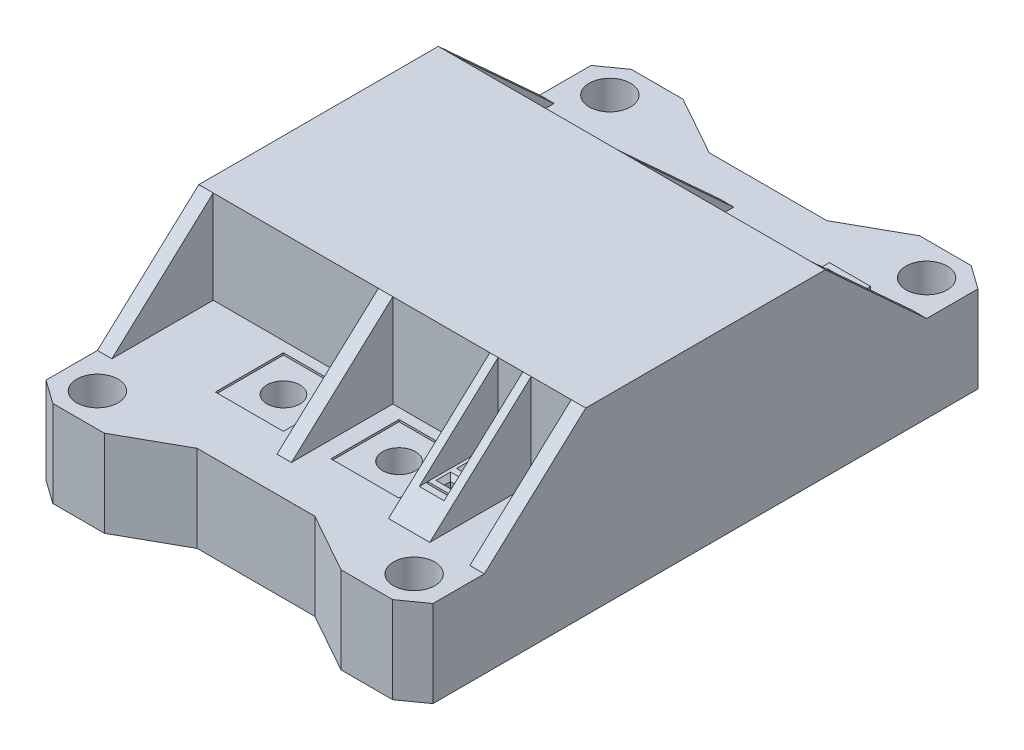
from build123d import *

# Parameters (mm, degrees)
BOSS_EXTRUDE1_DEPTH        = 10.668
SKETCH3_R                  = 2.54
CUT_EXTRUDE1_DEPTH         = 45.123624398
CHAMFER1_SIZE              = 0.00254
SKETCH4_W                  = 29.464
SKETCH4_H                  = 11.43
BOSS_EXTRUDE2_DEPTH        = 47.603865979
RIB1_REACH                 = 51.045
SKETCH5_WALL_W             = 117.009615236
SKETCH5_WALL_H             = 1.778
RIB2_REACH                 = 65.411
SKETCH6_WALL_W             = 145.742114112
SKETCH6_WALL_H             = 1.778
RIB3_START                 = -1.778
RIB3_DEPTH                 = 1.778
RIB4_START                 = -5.08
RIB4_DEPTH                 = 5.08
SKETCH9_W                  = 3.048
SKETCH9_H                  = 8.89
CUT_EXTRUDE2_DEPTH         = 60.891794651
SKETCH13_W                 = 2.54
SKETCH13_H                 = 8.128
BOSS_EXTRUDE3_DEPTH        = 0.254
SKETCH14_W                 = 0.762
SKETCH14_H                 = 0.762
CUT_EXTRUDE4_DEPTH         = 6.096
CHAMFER2_SIZE              = 0.508
LPATTERN1_COUNT            = 3
LPATTERN1_PITCH            = 2.54
CHAMFER2_OF_LPATTERN1_SIZE = 0.508
SKETCH15_W                 = 5.08
SKETCH15_H                 = 8.128
BOSS_EXTRUDE4_DEPTH        = 2.794
SKETCH16_W                 = 0.762
SKETCH16_H                 = 0.762
CUT_EXTRUDE5_DEPTH         = 6.096
CHAMFER3_SIZE              = 0.508
LPATTERN2_COUNT            = 3
LPATTERN2_PITCH            = 2.413
LPATTERN2_COUNT_DIR2       = 2
LPATTERN2_PITCH_DIR2       = 2.286
CHAMFER3_OF_LPATTERN2_SIZE = 0.508
SKETCH18_W                 = 8.382
SKETCH18_H                 = 8.382
CUT_EXTRUDE6_DEPTH         = 0.254
SKETCH19_R                 = 2.032
CUT_EXTRUDE7_DEPTH         = 45.380219265
MIRROR5_COPY_1_SKETCH_W    = 8.382
MIRROR5_COPY_1_SKETCH_H    = 8.382
MIRROR5_COPY_1_DEPTH       = 0.254
MIRROR5_COPY_2_SKETCH_R    = 2.032
MIRROR5_COPY_2_DEPTH       = 45.380219265


# Read off the part's stored shape, not the designer's step: Rib3, Rib4
with BuildPart() as part:
    # Sketch1 → Boss-Extrude1 (new body)
    with BuildSketch(Plane(origin=(0, 0, 0), x_dir=(1, 0, 0), z_dir=(0, 1, 0))):
        Polygon((0, 31.496), (7.239, 31.496), (14.553894525, 35.588705961), (20.903894525, 35.588705961), (23.801932989, 33.528), (23.801932989, 0), (0, 0), align=None)
    boss_extrude1 = extrude(amount=BOSS_EXTRUDE1_DEPTH)

    # Sketch3 → Cut-Extrude1 (cut, through all)
    with BuildSketch(Plane(origin=(0, 10.668, 0), x_dir=(1, 0, 0), z_dir=(0, 1, 0))):
        with Locations(Location((19.483932989, 31.524705961, 0), (0, 0, 270))):
            Circle(SKETCH3_R)
    cut_extrude1 = extrude(amount=-CUT_EXTRUDE1_DEPTH, mode=Mode.SUBTRACT)

    # Mirror1: Boss-Extrude1, Cut-Extrude1 across plane
    add(boss_extrude1.mirror(Plane(origin=(0, 0, 0), x_dir=(0, 0, 1), z_dir=(1, 0, 0))))
    add(cut_extrude1.mirror(Plane(origin=(0, 0, 0), x_dir=(0, 0, 1), z_dir=(1, 0, 0))), mode=Mode.SUBTRACT)

    # Mirror2: part across plane


with BuildPart() as part_1:
    add(part.part)
    add(part.part.mirror(Plane.XY))

    # Chamfer1
    chamfer1_edges = [part_1.edges().sort_by_distance(p)[0] for p in [
        (0, 10.668, -31.496),
        (0, 10.668, 31.496),
    ]]
    chamfer(chamfer1_edges, length=CHAMFER1_SIZE)

    # Sketch4 → Boss-Extrude2 (add)
    with BuildSketch(Plane(origin=(23.801932989, 0, 0), x_dir=(0, 0, -1), z_dir=(1, 0, 0))):
        with Locations((0, 16.383)):
            Rectangle(SKETCH4_W, SKETCH4_H)
    extrude(amount=-BOSS_EXTRUDE2_DEPTH)

    # Sketch5 wall → Rib1 (add, up to next)
    with BuildSketch(Plane(origin=(-1.703932989, 16.383, 20.96935298), x_dir=(0, -0.675559301544, 0.737305655816), z_dir=(0, -0.737305655816, -0.675559301544)), mode=Mode.PRIVATE) as rib1_sk1:
        with Locations((0, -0.889)):
            Rectangle(SKETCH5_WALL_W, SKETCH5_WALL_H)
    rib1_tool1 = extrude(rib1_sk1.sketch, amount=RIB1_REACH, mode=Mode.PRIVATE) - part_1.part
    rib1 = rib1_tool1.solids().sort_by_distance((-1.703932989, 16.383, 20.96935298))[0]
    add(rib1)

    # Sketch6 wall → Rib2 (add, up to next)
    with BuildSketch(Plane(origin=(23.801932989, 16.383, 20.96935298), x_dir=(0, -0.675559301544, 0.737305655816), z_dir=(0, -0.737305655816, -0.675559301544)), mode=Mode.PRIVATE) as rib2_sk1:
        with Locations((0, 0.889)):
            Rectangle(SKETCH6_WALL_W, SKETCH6_WALL_H)
    rib2_tool1 = extrude(rib2_sk1.sketch, amount=RIB2_REACH, mode=Mode.PRIVATE) - part_1.part
    rib2 = rib2_tool1.solids().sort_by_distance((23.801932989, 16.383, 20.96935298))[0]
    add(rib2)

    # Rib3 outline → Rib3 (add)
    with BuildSketch(Plane.ZY.offset(23.801932989).offset(RIB3_START)):
        Polygon((27.206705961, 10.668), (14.732, 22.098), (14.732, 10.668), align=None)
    rib3 = extrude(amount=RIB3_DEPTH)

    # Rib4 outline → Rib4 (add)
    with BuildSketch(Plane.ZY.offset(-12.012067011).offset(RIB4_START)):
        Polygon((27.206705961, 10.668), (14.732, 22.098), (14.732, 10.668), align=None)
    extrude(amount=RIB4_DEPTH)

    # Sketch9 → Cut-Extrude2 (cut, through all)
    with BuildSketch(Plane.XY.offset(14.732)):
        with Locations((14.552067011, 17.653)):
            Rectangle(SKETCH9_W, SKETCH9_H)
    extrude(amount=CUT_EXTRUDE2_DEPTH, mode=Mode.SUBTRACT)

    # Sketch13 → Boss-Extrude3 (add)
    with BuildSketch(Plane(origin=(0, 13.208, 0), x_dir=(1, 0, 0), z_dir=(0, 1, 0))):
        with Locations((14.552067011, -19.583274541)):
            Rectangle(SKETCH13_W, SKETCH13_H)
    extrude(amount=BOSS_EXTRUDE3_DEPTH)

    # Sketch14 → Cut-Extrude4 (cut)
    with BuildSketch(Plane(origin=(0, 13.462, 0), x_dir=(1, 0, 0), z_dir=(0, 1, 0))):
        with Locations((14.552067011, -17.043274541)):
            Rectangle(SKETCH14_W, SKETCH14_H)
    cut_extrude4 = extrude(amount=-CUT_EXTRUDE4_DEPTH, mode=Mode.SUBTRACT)

    # Chamfer2
    chamfer2_edges = [part_1.edges().sort_by_distance(p)[0] for p in [
        (14.933067011, 13.462, 17.043274541),
        (14.552067011, 13.462, 16.662274541),
        (14.171067011, 13.462, 17.043274541),
        (14.552067011, 13.462, 17.424274541),
    ]]
    chamfer(chamfer2_edges, length=CHAMFER2_SIZE)

    # LPattern1: Cut-Extrude4 ×3
    with Locations(*[(0, 0, i * LPATTERN1_PITCH) for i in range(1, LPATTERN1_COUNT)]):
        add(cut_extrude4, mode=Mode.SUBTRACT)

    # Chamfer2 of LPattern1
    chamfer2_of_lpattern1_edges = [part_1.edges().sort_by_distance(p)[0] for p in [
        (14.933067011, 13.462, 19.583274541),
        (14.552067011, 13.462, 19.202274541),
        (14.171067011, 13.462, 19.583274541),
        (14.552067011, 13.462, 19.964274541),
        (14.933067011, 13.462, 22.123274541),
        (14.552067011, 13.462, 21.742274541),
        (14.171067011, 13.462, 22.123274541),
        (14.552067011, 13.462, 22.504274541),
    ]]
    chamfer(chamfer2_of_lpattern1_edges, length=CHAMFER2_OF_LPATTERN1_SIZE)

    # Mirror3: Rib1, Rib2, Rib3 across plane
    add(rib1.mirror(Plane.XY))
    add(rib2.mirror(Plane.XY))
    add(rib3.mirror(Plane.XY))

    # Sketch15 → Boss-Extrude4 (add)
    with BuildSketch(Plane(origin=(0, 10.668, 0), x_dir=(1, 0, 0), z_dir=(0, 1, 0))):
        with Locations((17.197932989, 20.32)):
            Rectangle(SKETCH15_W, SKETCH15_H)
    extrude(amount=BOSS_EXTRUDE4_DEPTH)

    # Sketch16 → Cut-Extrude5 (cut)
    with BuildSketch(Plane(origin=(0, 13.462, 0), x_dir=(1, 0, 0), z_dir=(0, 1, 0))):
        with Locations((18.340932989, 17.907)):
            Rectangle(SKETCH16_W, SKETCH16_H)
    cut_extrude5 = extrude(amount=-CUT_EXTRUDE5_DEPTH, mode=Mode.SUBTRACT)

    # Chamfer3
    chamfer3_edges = [part_1.edges().sort_by_distance(p)[0] for p in [
        (18.721932989, 13.462, -17.907),
        (18.340932989, 13.462, -18.288),
        (17.959932989, 13.462, -17.907),
        (18.340932989, 13.462, -17.526),
    ]]
    chamfer(chamfer3_edges, length=CHAMFER3_SIZE)

    # LPattern2: Cut-Extrude5 3 × 2
    with Locations(*[(-j * LPATTERN2_PITCH_DIR2, 0, -i * LPATTERN2_PITCH) for i in range(LPATTERN2_COUNT) for j in range(LPATTERN2_COUNT_DIR2) if (i, j) != (0, 0)]):
        add(cut_extrude5, mode=Mode.SUBTRACT)

    # Chamfer3 of LPattern2
    chamfer3_of_lpattern2_edges = [part_1.edges().sort_by_distance(p)[0] for p in [
        (16.435932989, 13.462, -17.907),
        (16.054932989, 13.462, -18.288),
        (15.673932989, 13.462, -17.907),
        (16.054932989, 13.462, -17.526),
        (18.721932989, 13.462, -20.32),
        (18.340932989, 13.462, -20.701),
        (17.959932989, 13.462, -20.32),
        (18.340932989, 13.462, -19.939),
        (16.435932989, 13.462, -20.32),
        (16.054932989, 13.462, -20.701),
        (15.673932989, 13.462, -20.32),
        (16.054932989, 13.462, -19.939),
        (18.721932989, 13.462, -22.733),
        (18.340932989, 13.462, -23.114),
        (17.959932989, 13.462, -22.733),
        (18.340932989, 13.462, -22.352),
        (16.435932989, 13.462, -22.733),
        (16.054932989, 13.462, -23.114),
        (15.673932989, 13.462, -22.733),
        (16.054932989, 13.462, -22.352),
    ]]
    chamfer(chamfer3_of_lpattern2_edges, length=CHAMFER3_OF_LPATTERN2_SIZE)

    # Sketch18 → Cut-Extrude6 (cut)
    with BuildSketch(Plane(origin=(0, 10.668, 0), x_dir=(1, 0, 0), z_dir=(0, 1, 0))):
        with Locations((6.297067011, -20.193)):
            Rectangle(SKETCH18_W, SKETCH18_H)
    cut_extrude6 = extrude(amount=-CUT_EXTRUDE6_DEPTH, mode=Mode.SUBTRACT)

    # Sketch19 → Cut-Extrude7 (cut, through all)
    with BuildSketch(Plane(origin=(0, 10.414, 0), x_dir=(1, 0, 0), z_dir=(0, 1, 0))):
        with Locations(Location((6.297067011, -20.193, 0), (0, 0, 270))):
            Circle(SKETCH19_R)
    cut_extrude7 = extrude(amount=-CUT_EXTRUDE7_DEPTH, mode=Mode.SUBTRACT)

    # Mirror4: Cut-Extrude6, Cut-Extrude7 across plane
    add(cut_extrude6.mirror(Plane.ZY.offset(0.814932989)), mode=Mode.SUBTRACT)
    add(cut_extrude7.mirror(Plane.ZY.offset(0.814932989)), mode=Mode.SUBTRACT)

    # Mirror5: Cut-Extrude6, Cut-Extrude7 across plane
    add(cut_extrude6.mirror(Plane.XY), mode=Mode.SUBTRACT)
    add(cut_extrude7.mirror(Plane.XY), mode=Mode.SUBTRACT)

    # Mirror5 copy 1 sketch → Mirror5 copy 1 (cut)
    with BuildSketch(Plane(origin=(-1.629865979, 10.668, 0), x_dir=(-1, 0, 0), z_dir=(0, 1, 0))):
        with Locations((6.297067011, -20.193)):
            Rectangle(MIRROR5_COPY_1_SKETCH_W, MIRROR5_COPY_1_SKETCH_H)
    extrude(amount=-MIRROR5_COPY_1_DEPTH, mode=Mode.SUBTRACT)

    # Mirror5 copy 2 sketch → Mirror5 copy 2 (cut, through all)
    with BuildSketch(Plane(origin=(-1.629865979, 10.414, 0), x_dir=(-1, 0, 0), z_dir=(0, 1, 0))):
        with Locations(Location((6.297067011, -20.193, 0), (0, 0, 270))):
            Circle(MIRROR5_COPY_2_SKETCH_R)
    extrude(amount=-MIRROR5_COPY_2_DEPTH, mode=Mode.SUBTRACT)


solid = part_1.part
